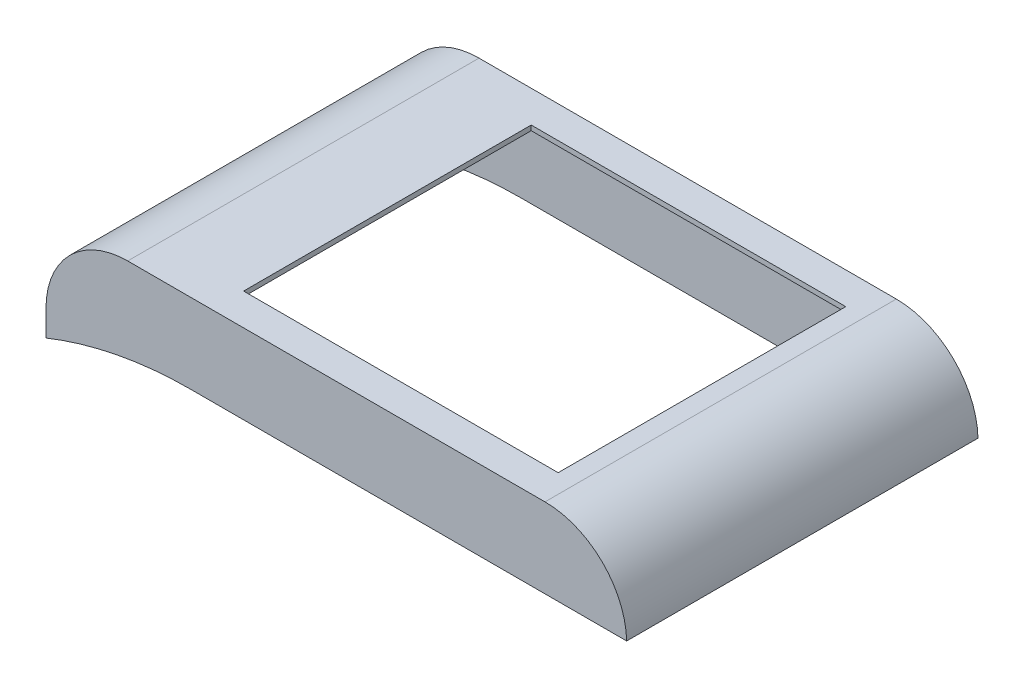
from build123d import *

# Parameters (mm, degrees)
BOSS_EXTRUDE1_DEPTH = 43
CUT_EXTRUDE1_START  = -8.55
SKETCH3_W           = 66.07
SKETCH3_H           = 38
CUT_EXTRUDE1_DEPTH  = 8.55
SKETCH4_W           = 47.5
SKETCH4_H           = 37
CUT_EXTRUDE2_DEPTH  = 0.6
CUT_EXTRUDE3_REACH  = 57.993
SKETCH5_W           = 38.5
SKETCH5_H           = 35.2
FILLET1_R           = 7
FILLET2_R           = 10
SKETCH6_W           = 0.5
SKETCH6_H           = 38
CUT_EXTRUDE4_DEPTH  = 10
SKETCH7_W           = 14.712909767
SKETCH7_H           = 38
BOSS_EXTRUDE2_DEPTH = 1.5
CUT_EXTRUDE5_REACH  = 57.044
SKETCH8_W           = 14.712909767
SKETCH8_H           = 38
SKETCH9_W           = 15
SKETCH9_H           = 38
BOSS_EXTRUDE3_DEPTH = 3


with BuildPart() as part:
    # Sketch1 → Boss-Extrude1 (new body)
    with BuildSketch(Plane.XY.offset(21.5)):
        with BuildLine():
            Line((21.074737692, 0), (21.074737692, 9.75))
            Line((21.074737692, 9.75), (-49.995262308, 9.75))
            Line((-49.995262308, 9.75), (-49.995262308, -3.418305859))
            ThreePointArc((-49.995262308, -3.418305859), (-41.302219327, -0.862388361), (-32.282352541, 0))
            Line((-32.282352541, 0), (21.074737692, 0))
        make_face()
    extrude(amount=-BOSS_EXTRUDE1_DEPTH)

    # Sketch3 → Cut-Extrude1 (cut)
    with BuildSketch(Plane(origin=(0, 8.55, 0), x_dir=(1, 0, 0), z_dir=(0, 1, 0)).offset(CUT_EXTRUDE1_START)):
        with Locations((-14.460262308, 0)):
            Rectangle(SKETCH3_W, SKETCH3_H)
    extrude(amount=CUT_EXTRUDE1_DEPTH, mode=Mode.SUBTRACT)

    # Sketch4 → Cut-Extrude2 (cut)
    with BuildSketch(Plane.XZ.offset(-8.55)):
        with Locations((-14.460262308, 0)):
            Rectangle(SKETCH4_W, SKETCH4_H)
    extrude(amount=-CUT_EXTRUDE2_DEPTH, mode=Mode.SUBTRACT)

    # Sketch5 → Cut-Extrude3 (cut, up to next)
    with BuildSketch(Plane(origin=(0, 9.75, 0), x_dir=(-1, 0, 0), z_dir=(0, 1, 0)), mode=Mode.PRIVATE) as cut_extrude3_sk1:
        with Locations((10.460262308, 0)):
            Rectangle(SKETCH5_W, SKETCH5_H)
    cut_extrude3_tool1 = extrude(cut_extrude3_sk1.sketch, amount=-CUT_EXTRUDE3_REACH, mode=Mode.PRIVATE) & part.part
    add(cut_extrude3_tool1.solids().sort_by_distance((-10.460262, 9.75, 0))[0], mode=Mode.SUBTRACT)

    # Fillet1
    fillet1_edges = [part.edges().sort_by_distance(p)[0] for p in [
        (18.574737692, 8.55, 0),
        (-47.495262308, 8.55, 0),
    ]]
    fillet(fillet1_edges, radius=FILLET1_R)

    # Fillet2
    # the kernel refuses this fillet: 10 mm, written as the material it takes off along each edge
    with BuildSketch(Plane(origin=(21.074737692, 9.75, 46.492186279), x_dir=(0, -1, 0), z_dir=(0, 0, -1))) as fillet2_piece_1:
        with BuildLine():
            CenterArc((10, 9.996874512), FILLET2_R, 180, 88.567456262)
            Line((0, 9.996874512), (-0.2, 9.996874512))
            Line((-0.2, 9.996874512), (-0.2, 0))
            Line((-0.2, 0), (0, -0.2))
            ThreePointArc((0, -0.2), (4.875, -0.2), (9.745, -0.19993749))
            Line((9.745, -0.19993749), (9.75, 0))
        make_face()
    extrude(amount=92.984372558, mode=Mode.SUBTRACT)
    with BuildSketch(Plane(origin=(-49.995262308, 9.75, 46.5), x_dir=(1, 0, 0), z_dir=(0, 0, -1))) as fillet2_piece_2:
        with BuildLine():
            CenterArc((FILLET2_R, FILLET2_R), FILLET2_R, 180, 90)
            Line((0, FILLET2_R), (-FILLET2_R * 0.02, FILLET2_R))
            Line((-FILLET2_R * 0.02, FILLET2_R), (-FILLET2_R * 0.02, -FILLET2_R * 0.02))
            Line((-FILLET2_R * 0.02, -FILLET2_R * 0.02), (FILLET2_R, -FILLET2_R * 0.02))
            Line((FILLET2_R, -FILLET2_R * 0.02), (FILLET2_R, 0))
        make_face()
    extrude(amount=93, mode=Mode.SUBTRACT)

    # Sketch6 → Cut-Extrude4 (cut)
    with BuildSketch(Plane(origin=(0, 0, 0), x_dir=(1, 0, 0), z_dir=(0, 1, 0))):
        with Locations((-32.532352541, 0)):
            Rectangle(SKETCH6_W, SKETCH6_H)
    extrude(amount=-CUT_EXTRUDE4_DEPTH, mode=Mode.SUBTRACT)

    # Sketch7 → Boss-Extrude2 (add)
    with BuildSketch(Plane(origin=(0, 0, 0), x_dir=(1, 0, 0), z_dir=(0, 1, 0))):
        with Locations((-40.138807425, 0)):
            Rectangle(SKETCH7_W, SKETCH7_H)
    extrude(amount=BOSS_EXTRUDE2_DEPTH)

    # Sketch8 → Cut-Extrude5 (cut, up to next)
    with BuildSketch(Plane(origin=(0, 1.5, 0), x_dir=(1, 0, 0), z_dir=(0, 1, 0)), mode=Mode.PRIVATE) as cut_extrude5_sk1:
        with Locations((-40.138807425, 0)):
            Rectangle(SKETCH8_W, SKETCH8_H)
    cut_extrude5_tool1 = extrude(cut_extrude5_sk1.sketch, amount=-CUT_EXTRUDE5_REACH, mode=Mode.PRIVATE) & part.part
    add(cut_extrude5_tool1.solids().sort_by_distance((-40.138807, 1.5, 0))[0], mode=Mode.SUBTRACT)

    # Sketch9 → Boss-Extrude3 (add)
    with BuildSketch(Plane.XZ):
        with Locations((11.074737692, 0)):
            Rectangle(SKETCH9_W, SKETCH9_H)
    extrude(amount=-BOSS_EXTRUDE3_DEPTH)


solid = part.part
